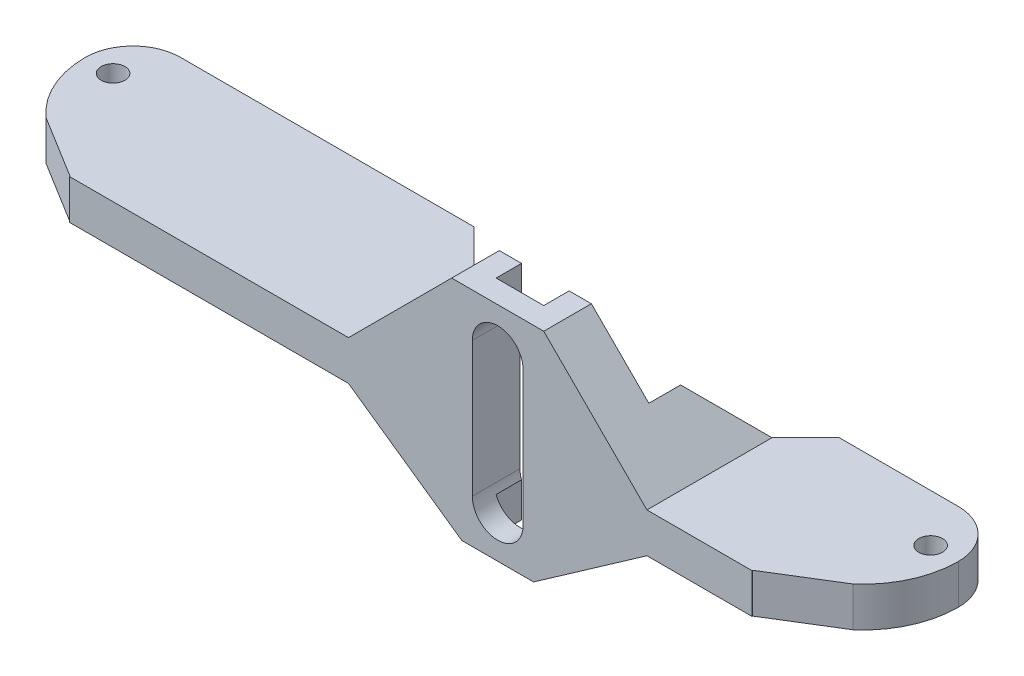
from build123d import *

# Parameters (mm, degrees)
BOSS_EXTRUDE1_DEPTH = 3
CUT_EXTRUDE1_DEPTH  = 10
CUT_EXTRUDE3_START  = 8
SKETCH8_W           = 6
SKETCH8_H           = 3
CUT_EXTRUDE3_DEPTH  = 6
BOSS_EXTRUDE4_START = 18
BOSS_EXTRUDE4_DEPTH = 28
BOSS_EXTRUDE5_DEPTH = 3
CUT_EXTRUDE4_DEPTH  = 3
CUT_EXTRUDE5_DEPTH  = 10
SKETCH18_R          = 1.5
BOSS_EXTRUDE9_DEPTH = 2
CHAMFER1_SIZE       = 15
CHAMFER2_SIZE       = 15
CHAMFER2_SIZE_2     = 10.503113073
CUT_EXTRUDE6_DEPTH  = 5
BOSS_EXTRUDE8_DEPTH = 2
CHAMFER3_DEPTH      = 6
CHAMFER3_2_DEPTH    = 5


with BuildPart() as part:
    # Sketch1 → Boss-Extrude1 (new body)
    with BuildSketch(Plane(origin=(0, 0, 0), x_dir=(1, 0, 0), z_dir=(0, 1, 0))):
        with BuildLine():
            ThreePointArc((-49, -6), (-53.242640687, -4.242640687), (-55, 0))
            ThreePointArc((-55, 0), (-51.485281374, -8.485281374), (-43, -12))
            Line((-43, -12), (43, -12))
            ThreePointArc((43, -12), (51.485281374, -8.485281374), (55, 0))
            ThreePointArc((55, 0), (53.242640687, -4.242640687), (49, -6))
            Line((49, -6), (-49, -6))
        make_face()
        with BuildLine():
            Line((-53, 0), (-55, 0))
            ThreePointArc((-55, 0), (-53.242640687, -4.242640687), (-49, -6))
            Line((-49, -6), (49, -6))
            ThreePointArc((49, -6), (53.242640687, -4.242640687), (55, 0))
            Line((55, 0), (53, 0))
            ThreePointArc((53, 0), (51.5, -1.5), (50, 0))
            Line((50, 0), (-50, 0))
            ThreePointArc((-50, 0), (-51.5, -1.5), (-53, 0))
        make_face()
        with BuildLine():
            Line((49, 6), (-49, 6))
            ThreePointArc((-49, 6), (-53.242640687, 4.242640687), (-55, 0))
            Line((-55, 0), (-53, 0))
            ThreePointArc((-53, 0), (-51.5, 1.5), (-50, 0))
            Line((-50, 0), (50, 0))
            ThreePointArc((50, 0), (51.5, 1.5), (53, 0))
            Line((53, 0), (55, 0))
            ThreePointArc((55, 0), (53.242640687, 4.242640687), (49, 6))
        make_face()
    extrude(amount=BOSS_EXTRUDE1_DEPTH)

    # Sketch2 → Cut-Extrude1 (cut)
    with BuildSketch(Plane(origin=(0, 3, 0), x_dir=(1, 0, 0), z_dir=(0, 1, 0))):
        Polygon((22, -8), (36, 6), (-14, 6), (0, -8), align=None)
    extrude(amount=-CUT_EXTRUDE1_DEPTH, mode=Mode.SUBTRACT)

    # Sketch8 → Cut-Extrude3 (cut)
    with BuildSketch(Plane.XY.offset(CUT_EXTRUDE3_START)):
        with Locations((10.960071178, 1.5)):
            Rectangle(SKETCH8_W, SKETCH8_H)
    extrude(amount=CUT_EXTRUDE3_DEPTH, mode=Mode.SUBTRACT)


with BuildPart() as cut_extrude3_piece_1:
    # of the separate pieces the step leaves, piece 1, a body of its own (cut_extrude3_pieces)
    add(part.part.solids().sort_by_distance((-55, 0, 0))[0])

    # Sketch9 → Boss-Extrude4 (add)
    with BuildSketch(Plane(origin=(0, 0, 0), x_dir=(1, 0, 0), z_dir=(0, 1, 0)).offset(BOSS_EXTRUDE4_START)):
        Polygon((13.960071178, -11.2), (13.960071178, -8), (14.760071178, -8), (14.760071178, -12), (7.160071178, -12), (7.160071178, -8), (7.960071178, -8), (7.960071178, -11.2), align=None)
    extrude(amount=-BOSS_EXTRUDE4_DEPTH)


with BuildPart() as cut_extrude3_piece_2:
    # of the separate pieces the step leaves, piece 2, a body of its own (cut_extrude3_pieces)
    add(part.part.solids().sort_by_distance((13.960071178, 0, 12))[0])


with BuildPart() as cut_extrude3_piece_1_1:
    add(cut_extrude3_piece_1.part)

    # Combine1: union Cut-Extrude3 piece 2
    add(cut_extrude3_piece_2.part)

    # Sketch11 → Boss-Extrude5 (add)
    with BuildSketch(Plane(origin=(0, 3, 0), x_dir=(1, 0, 0), z_dir=(0, 1, 0))):
        Polygon((-14, 6), (-12, 6), (2, -8), (0, -8), align=None)
        Polygon((20, -8), (34, 6), (36, 6), (22, -8), align=None)
    extrude(amount=-BOSS_EXTRUDE5_DEPTH)

    # Sketch13 → Cut-Extrude4 (cut)
    with BuildSketch(Plane(origin=(0, 3, 0), x_dir=(1, 0, 0), z_dir=(0, 1, 0))):
        Polygon((2, -8), (-2, -8), (-2, -4), align=None)
        Polygon((24, -4), (24, -8), (20, -8), align=None)
    extrude(amount=-CUT_EXTRUDE4_DEPTH, mode=Mode.SUBTRACT)

    # Sketch15 → Cut-Extrude5 (cut)
    with BuildSketch(Plane.XY.offset(12)):
        with BuildLine():
            Line((14.160071178, 12.5), (14.160071178, -4.5))
            ThreePointArc((14.160071178, -4.5), (10.960071178, -7.7), (7.760071178, -4.5))
            Line((7.760071178, -4.5), (7.760071178, 12.5))
            ThreePointArc((7.760071178, 12.5), (10.960071178, 15.7), (14.160071178, 12.5))
        make_face()
    extrude(amount=-CUT_EXTRUDE5_DEPTH, mode=Mode.SUBTRACT)

    # Sketch18 → Boss-Extrude9 (add)
    # profile 1 of 2: a face of its own
    with BuildSketch(Plane(origin=(0, 3, 0), x_dir=(1, 0, 0), z_dir=(0, 1, 0))):
        with BuildLine():
            Line((7.160071178, -12), (7.160071178, -8))
            Line((7.160071178, -8), (-2, -8))
            Line((-2, -8), (-2, -4))
            Line((-2, -4), (-12, 6))
            Line((-12, 6), (-49, 6))
            ThreePointArc((-49, 6), (-53.242640687, 4.242640687), (-55, 0))
            ThreePointArc((-55, 0), (-51.485281374, -8.485281374), (-43, -12))
            Line((-43, -12), (7.160071178, -12))
        make_face()
        with Locations((-51.5, 0)):
            Circle(SKETCH18_R, mode=Mode.SUBTRACT)
    # profile 2 of 2: a face of its own
    with BuildSketch(Plane(origin=(0, 3, 0), x_dir=(1, 0, 0), z_dir=(0, 1, 0))):
        with BuildLine():
            Line((34, 6), (24, -4))
            Line((24, -4), (24, -8))
            Line((24, -8), (14.760071178, -8))
            Line((14.760071178, -8), (14.760071178, -12))
            Line((14.760071178, -12), (43, -12))
            ThreePointArc((43, -12), (51.485281374, -8.485281374), (55, 0))
            ThreePointArc((55, 0), (53.242640687, 4.242640687), (49, 6))
            Line((49, 6), (34, 6))
        make_face()
        with Locations((51.5, 0)):
            Circle(SKETCH18_R, mode=Mode.SUBTRACT)
    extrude(amount=BOSS_EXTRUDE9_DEPTH)

    # Chamfer1
    # the kernel refuses this chamfer: 15 mm, written as the material it adds along each edge
    with BuildSketch(Plane(origin=(14.760071178, 5, 8), x_dir=(0, 1, 0), z_dir=(0, 0, 1))) as chamfer1_piece_1_section:
        Polygon((CHAMFER1_SIZE, 0), (0, -CHAMFER1_SIZE), (0, 0), align=None)
    chamfer1_piece_1 = extrude(amount=4, mode=Mode.PRIVATE)
    chamfer1_piece_1 = split(chamfer1_piece_1, bisect_by=Plane(origin=(14.760071178, 18, 8), z_dir=(0, -1, 0)), keep=Keep.TOP, mode=Mode.PRIVATE)
    chamfer1_piece_1 = split(chamfer1_piece_1, bisect_by=Plane(origin=(17.380035589, 5, 10.619964411), z_dir=(-0.7071067811865474, 0, -0.7071067811865477)), keep=Keep.TOP, mode=Mode.PRIVATE)
    add(chamfer1_piece_1)
    with BuildSketch(Plane(origin=(14.760071178, 5, -30.575244819), x_dir=(0, 1, 0), z_dir=(0, 0, 1))) as chamfer1_piece_2_section:
        Polygon((CHAMFER1_SIZE, 0), (0, -CHAMFER1_SIZE), (0, 0), align=None)
    chamfer1_piece_2 = extrude(amount=42.575244819, mode=Mode.PRIVATE)
    chamfer1_piece_2 = split(chamfer1_piece_2, bisect_by=Plane(origin=(14.760071178, 5, 8), z_dir=(0, 0, -1)), keep=Keep.TOP, mode=Mode.PRIVATE)
    chamfer1_piece_2 = split(chamfer1_piece_2, bisect_by=Plane(origin=(36.667657999, 5, -8.667657999), z_dir=(0.7071067811865474, 0, 0.7071067811865477)), keep=Keep.TOP, mode=Mode.PRIVATE)
    chamfer1_piece_2 = split(chamfer1_piece_2, bisect_by=Plane(origin=(24, 5, -30.575244819), z_dir=(1, 0, 0)), keep=Keep.TOP, mode=Mode.PRIVATE)
    add(chamfer1_piece_2)
    with BuildSketch(Plane(origin=(14.760071178, 5, 8), x_dir=(0, 1, 0), z_dir=(0, 0, 1))) as chamfer1_piece_3_section:
        Polygon((CHAMFER1_SIZE, 0), (0, -CHAMFER1_SIZE), (0, 0), align=None)
    chamfer1_piece_3 = extrude(amount=4, mode=Mode.PRIVATE)
    chamfer1_piece_3 = split(chamfer1_piece_3, bisect_by=Plane(origin=(14.760071178, 18, 8), z_dir=(0, -1, 0)), keep=Keep.TOP, mode=Mode.PRIVATE)
    chamfer1_piece_3 = split(chamfer1_piece_3, bisect_by=Plane(origin=(17.380035589, 5, 10.619964411), z_dir=(0.7071067811865474, 0, 0.7071067811865477)), keep=Keep.TOP, mode=Mode.PRIVATE)
    chamfer1_piece_3 = split(chamfer1_piece_3, bisect_by=Plane(origin=(24, 5, 8), z_dir=(-1, 0, 0)), keep=Keep.TOP, mode=Mode.PRIVATE)
    add(chamfer1_piece_3)
    with BuildSketch(Plane(origin=(14.760071178, 5, 8), x_dir=(0, 1, 0), z_dir=(0, 0, 1))) as chamfer1_piece_4_section:
        Polygon((CHAMFER1_SIZE, 0), (0, -CHAMFER1_SIZE), (0, 0), align=None)
    chamfer1_piece_4 = extrude(amount=4, mode=Mode.PRIVATE)
    chamfer1_piece_4 = split(chamfer1_piece_4, bisect_by=Plane(origin=(24, 5, 8), z_dir=(1, 0, 0)), keep=Keep.TOP, mode=Mode.PRIVATE)
    add(chamfer1_piece_4)
    with BuildSketch(Plane(origin=(7.160071178, 5, 12), x_dir=(0, 1, 0), z_dir=(0, 0, -1))) as chamfer1_piece_5_section:
        Polygon((CHAMFER1_SIZE, 0), (0, -CHAMFER1_SIZE), (0, 0), align=None)
    chamfer1_piece_5 = extrude(amount=4, mode=Mode.PRIVATE)
    chamfer1_piece_5 = split(chamfer1_piece_5, bisect_by=Plane(origin=(6.580035589, 5, 12.580035589), z_dir=(-0.7071067811865489, 0, 0.7071067811865461)), keep=Keep.TOP, mode=Mode.PRIVATE)
    chamfer1_piece_5 = split(chamfer1_piece_5, bisect_by=Plane(origin=(-2, 5, 12), z_dir=(1, 0, 0)), keep=Keep.TOP, mode=Mode.PRIVATE)
    chamfer1_piece_5 = split(chamfer1_piece_5, bisect_by=Plane(origin=(7.160071178, 18, 12), z_dir=(0, -1, 0)), keep=Keep.TOP, mode=Mode.PRIVATE)
    add(chamfer1_piece_5)
    with BuildSketch(Plane(origin=(7.160071178, 5, 12), x_dir=(0, 1, 0), z_dir=(0, 0, -1))) as chamfer1_piece_6_section:
        Polygon((CHAMFER1_SIZE, 0), (0, -CHAMFER1_SIZE), (0, 0), align=None)
    chamfer1_piece_6 = extrude(amount=4, mode=Mode.PRIVATE)
    chamfer1_piece_6 = split(chamfer1_piece_6, bisect_by=Plane(origin=(-2, 5, 12), z_dir=(-1, 0, 0)), keep=Keep.TOP, mode=Mode.PRIVATE)
    add(chamfer1_piece_6)
    with BuildSketch(Plane(origin=(7.160071178, 5, 12), x_dir=(0, 1, 0), z_dir=(0, 0, -1))) as chamfer1_piece_7_section:
        Polygon((CHAMFER1_SIZE, 0), (0, -CHAMFER1_SIZE), (0, 0), align=None)
    chamfer1_piece_7 = extrude(amount=4, mode=Mode.PRIVATE)
    chamfer1_piece_7 = split(chamfer1_piece_7, bisect_by=Plane(origin=(6.580035589, 5, 12.580035589), z_dir=(0.7071067811865489, 0, -0.7071067811865461)), keep=Keep.TOP, mode=Mode.PRIVATE)
    chamfer1_piece_7 = split(chamfer1_piece_7, bisect_by=Plane(origin=(7.160071178, 18, 12), z_dir=(0, -1, 0)), keep=Keep.TOP, mode=Mode.PRIVATE)
    add(chamfer1_piece_7)
    with BuildSketch(Plane(origin=(7.160071178, 5, 12), x_dir=(0, 1, 0), z_dir=(0, 0, -1))) as chamfer1_piece_8_section:
        Polygon((CHAMFER1_SIZE, 0), (0, -CHAMFER1_SIZE), (0, 0), align=None)
    chamfer1_piece_8 = extrude(amount=42.575244819, mode=Mode.PRIVATE)
    chamfer1_piece_8 = split(chamfer1_piece_8, bisect_by=Plane(origin=(6.580035589, 5, 12.580035589), z_dir=(-0.7071067811865489, 0, 0.7071067811865461)), keep=Keep.TOP, mode=Mode.PRIVATE)
    chamfer1_piece_8 = split(chamfer1_piece_8, bisect_by=Plane(origin=(-2, 5, 12), z_dir=(-1, 0, 0)), keep=Keep.TOP, mode=Mode.PRIVATE)
    chamfer1_piece_8 = split(chamfer1_piece_8, bisect_by=Plane(origin=(7.160071178, 5, 8), z_dir=(0, 0, -1)), keep=Keep.TOP, mode=Mode.PRIVATE)
    add(chamfer1_piece_8)

    # Chamfer2
    # the kernel refuses this chamfer: 15, 10.503113073 mm, written as the material it adds along each edge
    with BuildSketch(Plane(origin=(7.160071178, 0, 12), x_dir=(-1, 0, 0), z_dir=(0, 0, -1))) as chamfer2_piece_1_section:
        Polygon((CHAMFER2_SIZE, 0), (0, -CHAMFER2_SIZE_2), (0, 0), align=None)
    chamfer2_piece_1 = extrude(amount=4, mode=Mode.PRIVATE)
    chamfer2_piece_1 = split(chamfer2_piece_1, bisect_by=Plane(origin=(-2, 0, 12), z_dir=(-1, 0, 0)), keep=Keep.TOP, mode=Mode.PRIVATE)
    add(chamfer2_piece_1)
    with BuildSketch(Plane(origin=(7.160071178, 0, 12), x_dir=(-1, 0, 0), z_dir=(0, 0, -1))) as chamfer2_piece_2_section:
        Polygon((CHAMFER2_SIZE, 0), (0, -CHAMFER2_SIZE_2), (0, 0), align=None)
    chamfer2_piece_2 = extrude(amount=4, mode=Mode.PRIVATE)
    chamfer2_piece_2 = split(chamfer2_piece_2, bisect_by=Plane(origin=(6.580035589, 0, 12.580035589), z_dir=(-0.7071067811865476, 0, 0.7071067811865476)), keep=Keep.TOP, mode=Mode.PRIVATE)
    chamfer2_piece_2 = split(chamfer2_piece_2, bisect_by=Plane(origin=(-2, 0, 12), z_dir=(1, 0, 0)), keep=Keep.TOP, mode=Mode.PRIVATE)
    add(chamfer2_piece_2)
    with BuildSketch(Plane(origin=(7.160071178, 0, 12), x_dir=(-1, 0, 0), z_dir=(0, 0, -1))) as chamfer2_piece_3_section:
        Polygon((CHAMFER2_SIZE, 0), (0, -CHAMFER2_SIZE_2), (0, 0), align=None)
    chamfer2_piece_3 = extrude(amount=42.738283454, mode=Mode.PRIVATE)
    chamfer2_piece_3 = split(chamfer2_piece_3, bisect_by=Plane(origin=(6.580035589, 0, 12.580035589), z_dir=(-0.7071067811865476, 0, 0.7071067811865476)), keep=Keep.TOP, mode=Mode.PRIVATE)
    chamfer2_piece_3 = split(chamfer2_piece_3, bisect_by=Plane(origin=(7.160071178, 0, 8), z_dir=(0, 0, -1)), keep=Keep.TOP, mode=Mode.PRIVATE)
    chamfer2_piece_3 = split(chamfer2_piece_3, bisect_by=Plane(origin=(-2, 0, 12), z_dir=(-1, 0, 0)), keep=Keep.TOP, mode=Mode.PRIVATE)
    add(chamfer2_piece_3)
    with BuildSketch(Plane(origin=(7.160071178, 0, 12), x_dir=(-1, 0, 0), z_dir=(0, 0, -1))) as chamfer2_piece_4_section:
        Polygon((CHAMFER2_SIZE, 0), (0, -CHAMFER2_SIZE_2), (0, 0), align=None)
    chamfer2_piece_4 = extrude(amount=4, mode=Mode.PRIVATE)
    chamfer2_piece_4 = split(chamfer2_piece_4, bisect_by=Plane(origin=(6.580035589, 0, 12.580035589), z_dir=(0.7071067811865476, 0, -0.7071067811865476)), keep=Keep.TOP, mode=Mode.PRIVATE)
    chamfer2_piece_4 = split(chamfer2_piece_4, bisect_by=Plane(origin=(7.160071178, -10, 12), z_dir=(0, 1, 0)), keep=Keep.TOP, mode=Mode.PRIVATE)
    add(chamfer2_piece_4)
    with BuildSketch(Plane(origin=(14.760071178, 0, 12), x_dir=(0, -1, 0), z_dir=(0, 0, -1))) as chamfer2_piece_5_section:
        Polygon((CHAMFER2_SIZE_2, 0), (0, -CHAMFER2_SIZE), (0, 0), align=None)
    chamfer2_piece_5 = extrude(amount=4, mode=Mode.PRIVATE)
    chamfer2_piece_5 = split(chamfer2_piece_5, bisect_by=Plane(origin=(15.380035589, 0, 12.619964411), z_dir=(0.7071067811865476, 0, 0.7071067811865476)), keep=Keep.TOP, mode=Mode.PRIVATE)
    chamfer2_piece_5 = split(chamfer2_piece_5, bisect_by=Plane(origin=(24, 0, 12), z_dir=(-1, 0, 0)), keep=Keep.TOP, mode=Mode.PRIVATE)
    add(chamfer2_piece_5)
    with BuildSketch(Plane(origin=(14.760071178, 0, 12), x_dir=(0, -1, 0), z_dir=(0, 0, -1))) as chamfer2_piece_6_section:
        Polygon((CHAMFER2_SIZE_2, 0), (0, -CHAMFER2_SIZE), (0, 0), align=None)
    chamfer2_piece_6 = extrude(amount=4, mode=Mode.PRIVATE)
    chamfer2_piece_6 = split(chamfer2_piece_6, bisect_by=Plane(origin=(24, 0, 12), z_dir=(1, 0, 0)), keep=Keep.TOP, mode=Mode.PRIVATE)
    add(chamfer2_piece_6)
    with BuildSketch(Plane(origin=(14.760071178, 0, 12), x_dir=(0, -1, 0), z_dir=(0, 0, -1))) as chamfer2_piece_7_section:
        Polygon((CHAMFER2_SIZE_2, 0), (0, -CHAMFER2_SIZE), (0, 0), align=None)
    chamfer2_piece_7 = extrude(amount=4, mode=Mode.PRIVATE)
    chamfer2_piece_7 = split(chamfer2_piece_7, bisect_by=Plane(origin=(14.760071178, -10, 12), z_dir=(0, 1, 0)), keep=Keep.TOP, mode=Mode.PRIVATE)
    chamfer2_piece_7 = split(chamfer2_piece_7, bisect_by=Plane(origin=(15.380035589, 0, 12.619964411), z_dir=(-0.7071067811865476, 0, -0.7071067811865476)), keep=Keep.TOP, mode=Mode.PRIVATE)
    add(chamfer2_piece_7)
    with BuildSketch(Plane(origin=(14.760071178, 0, 12), x_dir=(0, -1, 0), z_dir=(0, 0, -1))) as chamfer2_piece_8_section:
        Polygon((CHAMFER2_SIZE_2, 0), (0, -CHAMFER2_SIZE), (0, 0), align=None)
    chamfer2_piece_8 = extrude(amount=42.738283454, mode=Mode.PRIVATE)
    chamfer2_piece_8 = split(chamfer2_piece_8, bisect_by=Plane(origin=(14.760071178, 0, 8), z_dir=(0, 0, -1)), keep=Keep.TOP, mode=Mode.PRIVATE)
    chamfer2_piece_8 = split(chamfer2_piece_8, bisect_by=Plane(origin=(15.380035589, 0, 12.619964411), z_dir=(0.7071067811865476, 0, 0.7071067811865476)), keep=Keep.TOP, mode=Mode.PRIVATE)
    chamfer2_piece_8 = split(chamfer2_piece_8, bisect_by=Plane(origin=(24, 0, 12), z_dir=(1, 0, 0)), keep=Keep.TOP, mode=Mode.PRIVATE)
    add(chamfer2_piece_8)

    # Sketch16 → Cut-Extrude6 (cut)
    with BuildSketch(Plane(origin=(0, 0, 0), x_dir=(1, 0, 0), z_dir=(0, 1, 0))):
        Polygon((-7.839928822, 1.839928822), (-2, -4), (-2, -8), (-7.839928822, -8), align=None)
        Polygon((24, -8), (24, -4), (29.760071178, 1.760071178), (29.760071178, -8), align=None)
    extrude(amount=-CUT_EXTRUDE6_DEPTH, mode=Mode.SUBTRACT)

    # Sketch17 → Boss-Extrude8 (add)
    with BuildSketch(Plane.XY.offset(12)):
        Polygon((-7.839928822, 0), (6.441551245, -10), (15.47859111, -10), (29.760071178, 0), (43, 0), (43, 5), (29.760071178, 5), (16.760071178, 18), (5.160071178, 18), (-7.839928822, 5), (-43, 5), (-43, 0), align=None)
        with BuildLine():
            Line((7.760071178, -4.5), (7.760071178, 12.5))
            ThreePointArc((7.760071178, 12.5), (10.960071178, 15.7), (14.160071178, 12.5))
            Line((14.160071178, 12.5), (14.160071178, -4.5))
            ThreePointArc((14.160071178, -4.5), (10.960071178, -7.7), (7.760071178, -4.5))
        make_face(mode=Mode.SUBTRACT)
    extrude(amount=BOSS_EXTRUDE8_DEPTH)

    # Chamfer3: read off the stored shape, not the designer's step
    # Chamfer3 outline → Chamfer3 (cut)
    with BuildSketch(Plane(origin=(0, 0, 0), x_dir=(1, 0, 0), z_dir=(0, 1, 0))):
        with BuildLine():
            ThreePointArc((47.608318931, -11.079864468), (49.300429772, -10.212961602), (50.834384089, -9.08968789))
            Line((50.834384089, -9.08968789), (47.608318931, -11.079864468))
        make_face()
        with BuildLine():
            ThreePointArc((-50.834384089, -9.08968789), (-49.300429772, -10.212961602), (-47.608318931, -11.079864468))
            Line((-47.608318931, -11.079864468), (-50.834384089, -9.08968789))
        make_face()
    extrude(amount=CHAMFER3_DEPTH, mode=Mode.SUBTRACT)

    # Chamfer3 2 outline → Chamfer3 2 (add)
    with BuildSketch(Plane(origin=(0, 0, 0), x_dir=(1, 0, 0), z_dir=(0, 1, 0))):
        with BuildLine():
            Line((43, -13.922760673), (47.608318931, -11.079864468))
            ThreePointArc((47.608318931, -11.079864468), (45.349641077, -11.767717995), (43, -12))
            Line((43, -12), (43, -13.922760673))
        make_face()
        with BuildLine():
            Line((-47.608318931, -11.079864468), (-43, -13.922760673))
            Line((-43, -13.922760673), (-43, -12))
            ThreePointArc((-43, -12), (-45.349641077, -11.767717995), (-47.608318931, -11.079864468))
        make_face()
    extrude(amount=CHAMFER3_2_DEPTH)


solid = cut_extrude3_piece_1_1.part
